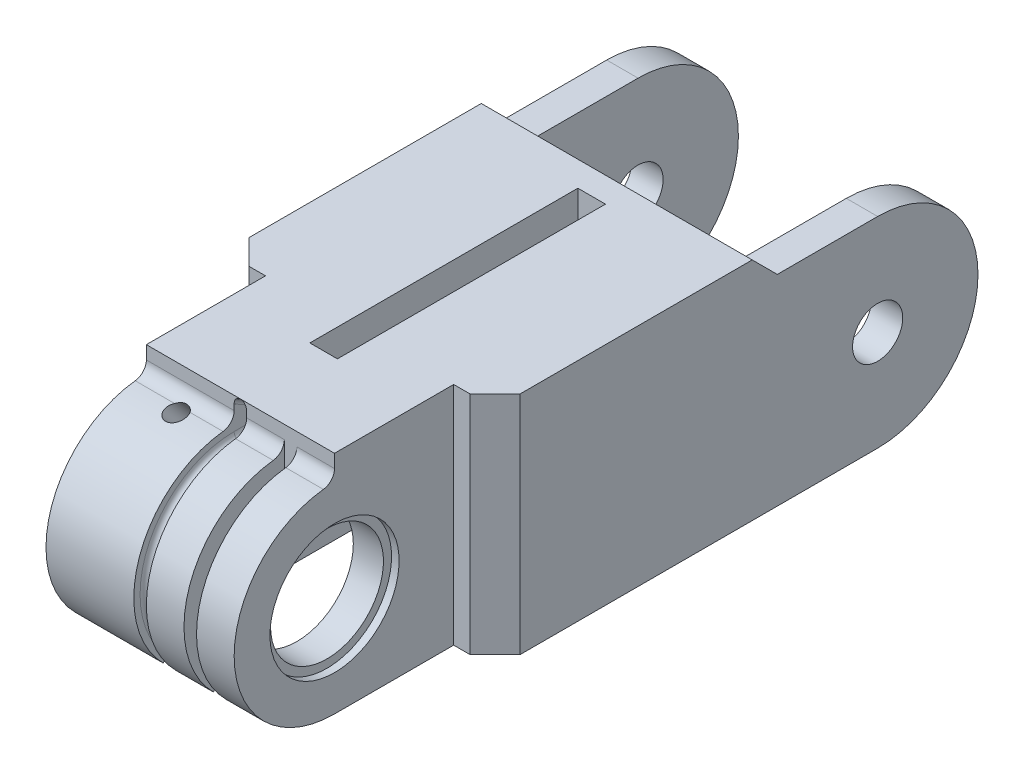
from build123d import *
from build123d.topology import SkipClean

# Parameters (mm, degrees)
BOSS_EXTRU_1_START      = 4.5
ESQUISSE1_R             = 2
BOSS_EXTRU_1_DEPTH      = 3
BOSS_EXTRU_2_START      = 7.5
BOSS_EXTRU_2_DEPTH      = 3.3
BOSS_EXTRU_5_START      = 8.3
ESQUISSE1_12_R          = 2
BOSS_EXTRU_5_DEPTH      = 2.5
BOSS_EXTRU_3_DEPTH      = 7.5
BOSS_EXTRU_4_START      = 0.5
BOSS_EXTRU_4_DEPTH      = 7
CONG_4_R                = 12
FILLET1_R               = 0.5
FILLET2_R               = 1
CHAMFER1_SIZE           = 2
ENL_V_START             = 4.5
ESQUISSE2_W             = 8
ESQUISSE2_H             = 18
ENL_V_MAT_EXTRU_1_DEPTH = 1
ENL_V_MAT_EXTRU_3_REACH = 52.206
ESQUISSE4_R             = 0.75
ESQUISSE5_W             = 21.366750419
ESQUISSE5_H             = 3.6
ENL_V_MAT_EXTRU_4_DEPTH = 1.1
CONG_5_R                = 1.1
ENL_V_MAT_EXTRU_5_REACH = 59.505
ESQUISSE12_R            = 0.75


# Some blends are built 0.0001 mm under size
with BuildPart() as part:
    # Esquisse1 → Boss.-Extru.1 (new body)
    with BuildSketch(Plane(origin=(0, 0, 0), x_dir=(0, 0, -1), z_dir=(1, 0, 0)).offset(BOSS_EXTRU_1_START)):
        with BuildLine():
            Line((30, 10), (0, 10))
            Line((0, 10), (0, 8))
            ThreePointArc((0, 8), (-8, 0), (0, -8))
            Line((0, -8), (30.291756081, -8))
            Line((30.291756081, -8), (30.291756081, 0))
            ThreePointArc((30.291756081, 0), (30.728647581, 2.879587526), (32, 5.5))
            Line((32, 5.5), (32, 8))
            Line((32, 8), (30, 10))
        make_face()
        Circle(ESQUISSE1_R, mode=Mode.SUBTRACT)
    extrude(amount=BOSS_EXTRU_1_DEPTH)

    # Esquisse1<8> → Boss.-Extru.2 (add)
    with BuildSketch(Plane(origin=(0, 0, 0), x_dir=(0, 0, -1), z_dir=(1, 0, 0)).offset(BOSS_EXTRU_2_START)):
        with BuildLine():
            Line((30, 10), (9.5, 10))
            Line((9.5, 10), (9.5, -8))
            Line((9.5, -8), (30.291756081, -8))
            Line((30.291756081, -8), (30.291756081, 0))
            ThreePointArc((30.291756081, 0), (30.728647581, 2.879587526), (32, 5.5))
            Line((32, 5.5), (32, 8))
            Line((32, 8), (30, 10))
        make_face()
    extrude(amount=BOSS_EXTRU_2_DEPTH)

    # Esquisse1<12> → Boss.-Extru.5 (add)
    with BuildSketch(Plane(origin=(0, 0, 0), x_dir=(0, 0, -1), z_dir=(1, 0, 0)).offset(BOSS_EXTRU_5_START)):
        with BuildLine():
            Line((40, 8), (32, 8))
            Line((32, 8), (32, 7))
            Line((32, 7), (32, 5.5))
            ThreePointArc((32, 5.5), (30.728647581, 2.879587526), (30.291756081, 0))
            Line((30.291756081, 0), (30.291756081, -8))
            Line((30.291756081, -8), (40, -8))
            ThreePointArc((40, -8), (48, 0), (40, 8))
        make_face()
        with Locations((40, 0)):
            Circle(ESQUISSE1_12_R, mode=Mode.SUBTRACT)
    extrude(amount=BOSS_EXTRU_5_DEPTH)

    # Esquisse1<9> → Boss.-Extru.3 (add)
    with BuildSketch(Plane(origin=(0, 0, 0), x_dir=(0, 0, -1), z_dir=(1, 0, 0))):
        with BuildLine():
            Line((0, 10), (2, 8))
            Line((2, 8), (28, 8))
            ThreePointArc((28, 8), (29.530733729, 8.30448187), (30.828427125, 9.171572875))
            Line((30.828427125, 9.171572875), (30, 10))
            Line((30, 10), (0, 10))
        make_face()
        with BuildLine():
            Line((0, 5.5), (28.791756081, 5.5))
            Line((28.791756081, 5.5), (28.791756081, -8))
            Line((28.791756081, -8), (30.291756081, -8))
            Line((30.291756081, -8), (30.291756081, 0))
            ThreePointArc((30.291756081, 0), (30.728647581, 2.879587526), (32, 5.5))
            Line((32, 5.5), (32, 7))
            Line((32, 7), (0, 7))
            ThreePointArc((0, 7), (-6.467156728, 2.678784027), (-4.949747468, -4.949747468))
            Line((-4.949747468, -4.949747468), (-3.889087297, -3.889087297))
            ThreePointArc((-3.889087297, -3.889087297), (-5.081337429, 2.104758878), (0, 5.5))
        make_face()
    extrude(amount=BOSS_EXTRU_3_DEPTH)

    # Esquisse1<10> → Boss.-Extru.4 (add)
    with BuildSketch(Plane(origin=(0, 0, 0), x_dir=(0, 0, -1), z_dir=(1, 0, 0)).offset(BOSS_EXTRU_4_START)):
        with BuildLine():
            Line((2, 8), (0, 10))
            Line((0, 10), (0, 8))
            ThreePointArc((0, 8), (-7.39103626, 3.061467459), (-5.656854249, -5.656854249))
            Line((-5.656854249, -5.656854249), (-4.949747468, -4.949747468))
            ThreePointArc((-4.949747468, -4.949747468), (-6.467156728, 2.678784027), (0, 7))
            Line((0, 7), (32, 7))
            Line((32, 7), (32, 8))
            Line((32, 8), (30.828427125, 9.171572875))
            ThreePointArc((30.828427125, 9.171572875), (29.530733729, 8.30448187), (28, 8))
            Line((28, 8), (2, 8))
        make_face()
    extrude(amount=BOSS_EXTRU_4_DEPTH)

    # Congé4
    # the kernel refuses this fillet: 12 mm, written as the material it takes off along each edge
    with BuildSketch(Plane(origin=(-11.583123952, 8, -2), x_dir=(0, 0, -1), z_dir=(1, 0, 0))) as cong_4_piece_1:
        with BuildLine():
            CenterArc((4.633249581, 12), CONG_4_R, 236.442690238, 33.557309762)
            Line((-2, 2), (-2.132664992, 1.8))
            ThreePointArc((-2.132664992, 1.8), (-1.169705627, 0.830294373), (-0.169705627, -0.169705627))
            Line((-0.169705627, -0.169705627), (0, -0.24))
            Line((0, -0.24), (4.633249581, -0.24))
            Line((4.633249581, -0.24), (4.633249581, 0))
        make_face()
    extrude(amount=12.083123952, mode=Mode.SUBTRACT)

    # Fillet1
    # the kernel refuses this fillet: 0.5 mm, written as the material it adds along each edge
    with BuildSketch(Plane(origin=(0.5, 20, -6.633249581), x_dir=(0, -0.7713363788823462, 0.6364276790120538), z_dir=(0, 0.6364276790120538, 0.7713363788823462))) as fillet1_piece_1_section:
        with BuildLine():
            CenterArc((12 + FILLET1_R, -FILLET1_R), FILLET1_R, 90, 90)
            Line((12 + FILLET1_R, 0), (12, 0))
            Line((12, 0), (12, -FILLET1_R))
        make_face()
    fillet1_piece_1 = revolve(axis=Axis((0.5, 20, -6.633249581), (1, 0, 0)), revolution_arc=39.525953359, mode=Mode.PRIVATE)
    fillet1_piece_1 = split(fillet1_piece_1, bisect_by=Plane(origin=(0.358961784, 10, -3.12843374), z_dir=(0, -1, 0)), keep=Keep.TOP, mode=Mode.PRIVATE)
    fillet1_piece_1 = split(fillet1_piece_1, bisect_by=Plane(origin=(0.358961784, 8.375840896, 0), z_dir=(0, 0, -1)), keep=Keep.TOP, mode=Mode.PRIVATE)
    add(fillet1_piece_1)
    with BuildSketch(Plane(origin=(0.5, 8, -28), x_dir=(-1, 0, 0), z_dir=(0, 0, 1))) as fillet1_piece_2:
        with BuildLine():
            CenterArc((FILLET1_R, FILLET1_R), FILLET1_R, 180, 90)
            Line((0, FILLET1_R), (0, 0))
            Line((0, 0), (FILLET1_R, 0))
        make_face()
    extrude(amount=21.366750419)
    with BuildSketch(Plane(origin=(0.5, 7, 0), x_dir=(-1, 0, 0), z_dir=(0, 0, -1))) as fillet1_piece_3:
        with BuildLine():
            CenterArc((FILLET1_R, FILLET1_R), FILLET1_R, 180, 90)
            Line((0, FILLET1_R), (0, 0))
            Line((0, 0), (FILLET1_R, 0))
        make_face()
    extrude(amount=32)
    with BuildSketch(Plane(origin=(0.5, 0, 0), x_dir=(0, -0.7071067811865441, 0.7071067811865509), z_dir=(0, -0.7071067811865509, -0.7071067811865441))) as fillet1_piece_4:
        with BuildLine():
            CenterArc((7 + FILLET1_R, FILLET1_R), FILLET1_R, 180, 90)
            Line((7 + FILLET1_R, 0), (7, 0))
            Line((7, 0), (7, FILLET1_R))
        make_face()
    revolve(axis=Axis((0.5, 0, 0), (-1, 0, 0)), revolution_arc=135)
    with BuildSketch(Plane(origin=(0.5, 12, -28), x_dir=(0, -0.7071067811865426, -0.7071067811865523), z_dir=(0, 0.7071067811865523, -0.7071067811865426))) as fillet1_piece_5:
        with BuildLine():
            CenterArc((4 + FILLET1_R, FILLET1_R), FILLET1_R, 180, 90)
            Line((4 + FILLET1_R, 0), (4, 0))
            Line((4, 0), (4, FILLET1_R))
        make_face()
    revolve(axis=Axis((0.5, 12, -28), (-1, 0, 0)), revolution_arc=45)

    # Fillet2
    fillet2_edges = [part.edges().sort_by_distance(p)[0] for p in [
        (4, 8, 0),
    ]]
    fillet(fillet2_edges, radius=FILLET2_R)

    # Chamfer1
    chamfer1_edges = [part.edges().sort_by_distance(p)[0] for p in [
        (10.8, 1, -9.5),
    ]]
    chamfer(chamfer1_edges, length=CHAMFER1_SIZE)

    # Symétrie1: part across plane


with BuildPart() as part_1:
    add(part.part)
    add(part.part.mirror(Plane(origin=(0, 0, 0), x_dir=(0, 0, 1), z_dir=(1, 0, 0))))

    # Esquisse2 → Enlèv. mat.-Extru.1 (cut)
    with SkipClean():  # the faces are left unmerged after this step: merging them gives an invalid solid
        with BuildSketch(Plane(origin=(0, 0, 0), x_dir=(0, 0, -1), z_dir=(1, 0, 0)).offset(ENL_V_START)):
            with Locations((-4, 1)):
                Rectangle(ESQUISSE2_W, ESQUISSE2_H)
        extrude(amount=-ENL_V_MAT_EXTRU_1_DEPTH, mode=Mode.SUBTRACT)

    # Esquisse4 → Enlèv. mat.-Extru.3 (cut, up to next)
    with BuildSketch(Plane.XY, mode=Mode.PRIVATE) as enl_v_mat_extru_3_sk1:
        with Locations((3.75, -3.8608)):
            Circle(ESQUISSE4_R)
    enl_v_mat_extru_3_tool1 = extrude(enl_v_mat_extru_3_sk1.sketch, amount=-ENL_V_MAT_EXTRU_3_REACH, mode=Mode.PRIVATE) & part_1.part
    add(enl_v_mat_extru_3_tool1.solids().sort_by_distance((3.75, -3.8608, 0))[0], mode=Mode.SUBTRACT)

    # Esquisse5 → Enlèv. mat.-Extru.4 (cut, symmetric)
    with SkipClean():  # the faces are left unmerged after this step: merging them gives an invalid solid
        with BuildSketch(Plane(origin=(0, 0, 0), x_dir=(0, 0, -1), z_dir=(1, 0, 0))):
            with Locations((17.316624791, 8.2)):
                Rectangle(ESQUISSE5_W, ESQUISSE5_H)
        extrude(amount=ENL_V_MAT_EXTRU_4_DEPTH, both=True, mode=Mode.SUBTRACT)

    # Congé5
    cong_5_edges = [part_1.edges().sort_by_distance(p)[0] for p in [
        (1.1, 6.4, -17.31662479),
        (-1.1, 6.4, -17.31662479),
    ]]
    fillet(cong_5_edges, radius=CONG_5_R - 0.0001)  # a hair under: the kernel refuses the full size

    # Esquisse10 → Enlèvement de matière-Révolution1 (revolve, cut)
    with BuildSketch(Plane.XY, mode=Mode.PRIVATE) as enl_vement_de_mati_re_r_volution1_sk:
        Polygon((-7.5, 5.15), (-6.9, 5.15), (-6.9, 4.5), (6.9, 4.5), (6.9, 5.15), (7.5, 5.15), (7.5, 2), (-7.5, 2), align=None)
    revolve(enl_vement_de_mati_re_r_volution1_sk.sketch.rotate(Axis((-7.5, 0, 0), (1, 0, 0)), 90), axis=Axis((-7.5, 0, 0), (1, 0, 0)), mode=Mode.SUBTRACT)

    # Esquisse12 → Enlèv. mat.-Extru.5 (cut, up to next)
    with BuildSketch(Plane(origin=(0, 7.263410428, 6.380108848), x_dir=(1, 0, 0), z_dir=(0, -0.7538821952908842, -0.6570096160813761)), mode=Mode.PRIVATE) as enl_v_mat_extru_5_sk1:
        with Locations(Location((-3.75, -4.165219968, 0), (0, 0, 136.743720403))):
            Circle(ESQUISSE12_R)
    enl_v_mat_extru_5_tool1 = extrude(enl_v_mat_extru_5_sk1.sketch, amount=ENL_V_MAT_EXTRU_5_REACH, mode=Mode.PRIVATE) & part_1.part
    add(enl_v_mat_extru_5_tool1.solids().sort_by_distance((-3.75, 10, 3.240024))[0], mode=Mode.SUBTRACT)


solid = part_1.part
